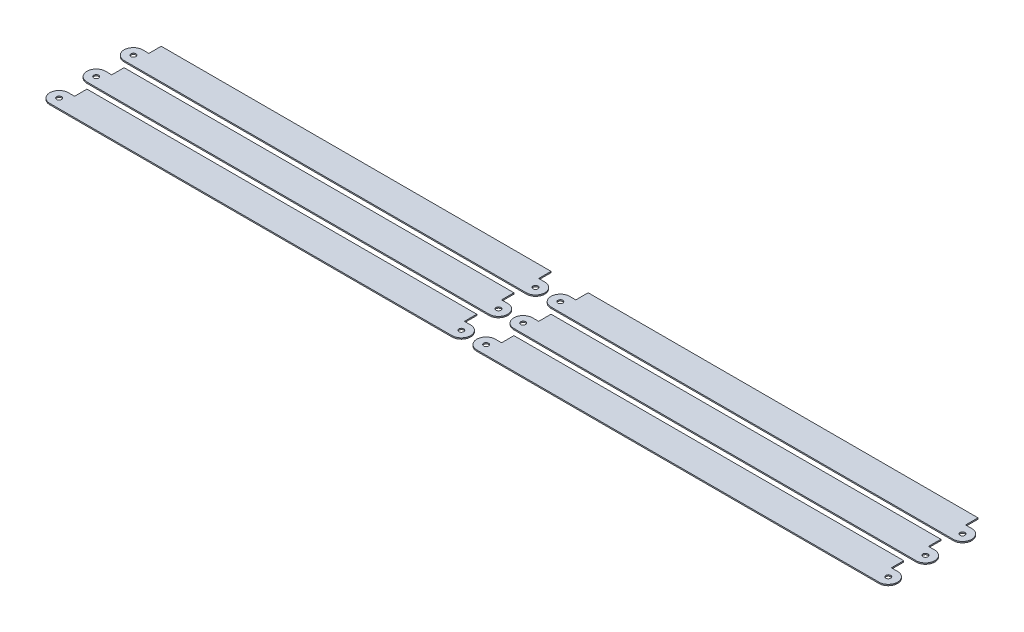
from build123d import *

# Parameters (mm, degrees)
SKETCH1_R           = 2
BOSS_EXTRUDE1_DEPTH = 1
LPATTERN1_COUNT     = 3
LPATTERN1_PITCH     = 30
LPATTERN1_2_COUNT   = 2
LPATTERN1_2_PITCH   = 345


with BuildPart() as part:
    # Sketch1 → Boss-Extrude1 (new body)
    with BuildSketch(Plane(origin=(0, 0, 0), x_dir=(1, 0, 0), z_dir=(0, 1, 0))):
        with BuildLine():
            Line((5, 7.5), (0, 7.5))
            ThreePointArc((0, 7.5), (-4.937104415, 5.645794895), (-7.433034374, 1))
            Line((-7.433034374, 1), (-7.5, 1))
            Line((-7.5, 1), (-7.5, -1))
            Line((-7.5, -1), (-7.433034374, -1))
            ThreePointArc((-7.433034374, -1), (-4.937104415, -5.645794895), (0, -7.5))
            Line((0, -7.5), (325, -7.5))
            ThreePointArc((325, -7.5), (329.937104415, -5.645794895), (332.433034374, -1))
            Line((332.433034374, -1), (332.5, -1))
            Line((332.5, -1), (332.5, 1))
            Line((332.5, 1), (332.433034374, 1))
            ThreePointArc((332.433034374, 1), (329.937104415, 5.645794895), (325, 7.5))
            Line((325, 7.5), (320, 7.5))
            Line((320, 7.5), (320, 17.5))
            Line((320, 17.5), (5, 17.5))
            Line((5, 17.5), (5, 7.5))
        make_face()
        Circle(SKETCH1_R, mode=Mode.SUBTRACT)
        with Locations((325, 0)):
            Circle(SKETCH1_R, mode=Mode.SUBTRACT)
    extrude(amount=BOSS_EXTRUDE1_DEPTH)


with BuildPart() as lpattern1_1:
    # LPattern1: pattern copy
    add(part.part.moved(Location(Vector(0, 0, -1) * (1 * LPATTERN1_PITCH))))


with BuildPart() as lpattern1_2:
    # LPattern1: pattern copy
    add(part.part.moved(Location(Vector(0, 0, -1) * (2 * LPATTERN1_PITCH))))


with BuildPart() as lpattern1_2_1:
    # LPattern1 2: pattern copy
    add(part.part.moved(Location(Vector(1, 0, 0) * (1 * LPATTERN1_2_PITCH))))


with BuildPart() as lpattern1_2_2:
    # LPattern1 2: pattern copy
    add(lpattern1_1.part.moved(Location(Vector(1, 0, 0) * (1 * LPATTERN1_2_PITCH))))


with BuildPart() as lpattern1_2_3:
    # LPattern1 2: pattern copy
    add(lpattern1_2.part.moved(Location(Vector(1, 0, 0) * (1 * LPATTERN1_2_PITCH))))


solid = Compound([part.part, lpattern1_1.part, lpattern1_2.part, lpattern1_2_1.part, lpattern1_2_2.part, lpattern1_2_3.part])
